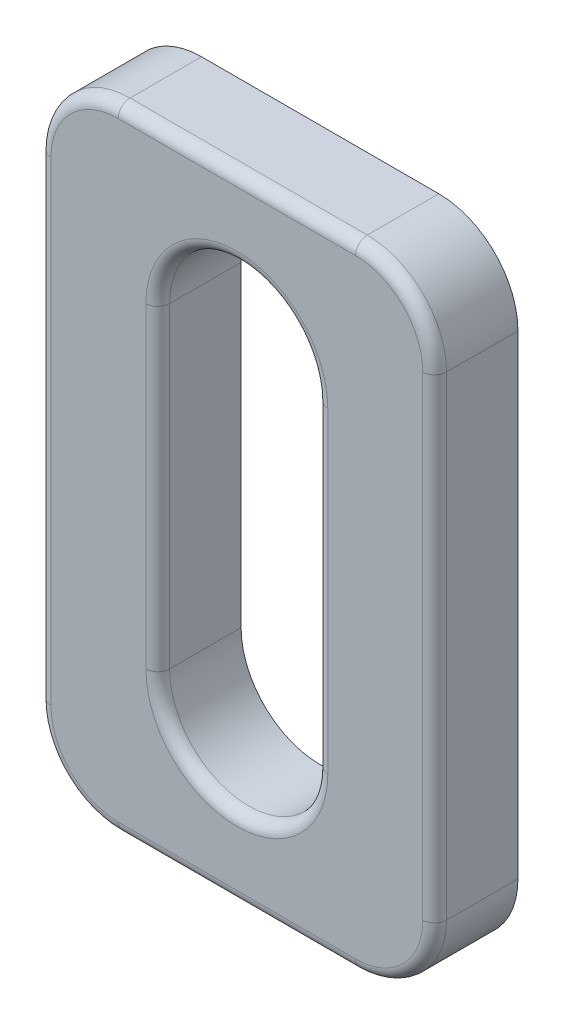
from build123d import *

# Parameters (mm, degrees)
SKETCH1_W           = 25
SKETCH1_H           = 40
BOSS_EXTRUDE1_DEPTH = 5.2671
FILLET1_R           = 5
FILLET2_R           = 0.75


with BuildPart() as part:
    # Sketch1 → Boss-Extrude1 (new body)
    with BuildSketch(Plane.XY):
        with Locations((12.5, 20)):
            Rectangle(SKETCH1_W, SKETCH1_H)
        with BuildLine():
            Line((17.5, 30), (17.5, 10))
            ThreePointArc((17.5, 10), (12.5, 5), (7.5, 10))
            Line((7.5, 10), (7.5, 30))
            ThreePointArc((7.5, 30), (12.5, 35), (17.5, 30))
        make_face(mode=Mode.SUBTRACT)
    extrude(amount=BOSS_EXTRUDE1_DEPTH)

    # Fillet1
    fillet1_edges = [part.edges().sort_by_distance(p)[0] for p in [
        (25, 40, 2.63355),
        (25, 0, 2.63355),
        (0, 0, 2.63355),
        (0, 40, 2.63355),
    ]]
    fillet(fillet1_edges, radius=FILLET1_R)

    # Fillet2
    fillet2_edges = [part.edges().sort_by_distance(p)[0] for p in [
        (1.464466094, 1.464466094, 5.2671),
        (0, 20, 5.2671),
        (1.464466094, 38.535533906, 5.2671),
        (23.535533906, 38.535533906, 5.2671),
        (12.5, 40, 5.2671),
        (25, 20, 5.2671),
        (23.535533906, 1.464466094, 5.2671),
        (12.5, 0, 5.2671),
        (12.5, 5, 5.2671),
        (17.5, 20, 5.2671),
        (12.5, 35, 5.2671),
        (7.5, 20, 5.2671),
    ]]
    fillet(fillet2_edges, radius=FILLET2_R)


solid = part.part
